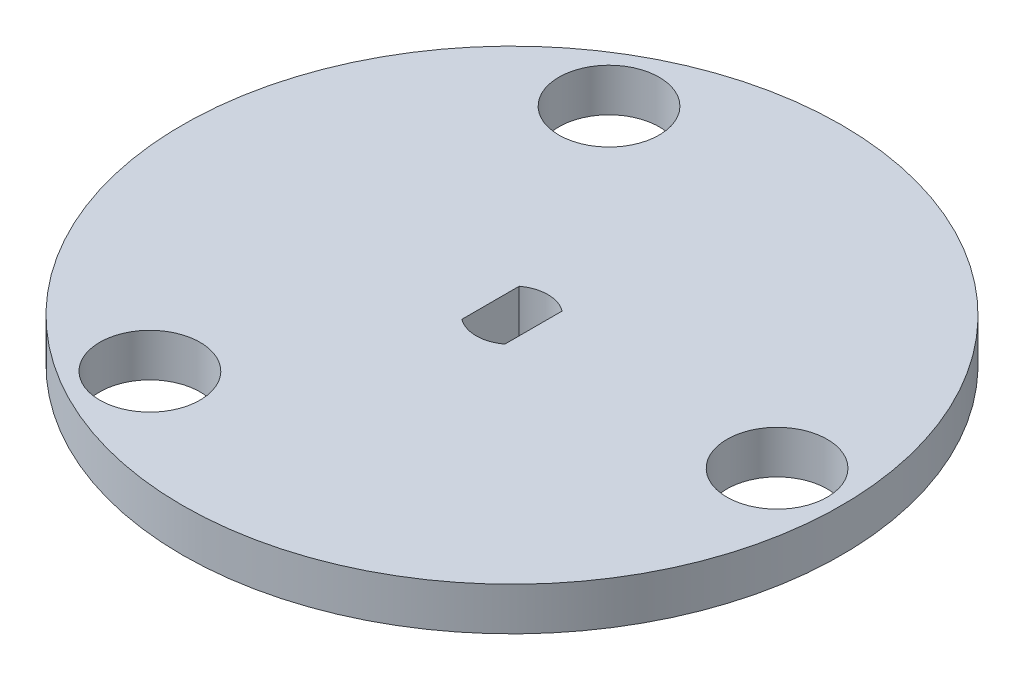
from build123d import *

# Parameters (mm, degrees)
CROQUIS1_R              = 23
CROQUIS1_R_2            = 3.5
SALIENTE_EXTRUIR1_DEPTH = 3


with BuildPart() as part:
    # Croquis1 → Saliente-Extruir1 (new body)
    with BuildSketch(Plane(origin=(0, 0, 0), x_dir=(1, 0, 0), z_dir=(0, 1, 0))):
        Circle(CROQUIS1_R)
        with BuildLine():
            ThreePointArc((-5.75, -16.02146997), (-12.281088913, -17.77146997), (-7.5, -12.990381057))
            ThreePointArc((-7.5, -12.990381057), (-6.218911087, -14.27146997), (-5.75, -16.02146997))
        make_face(mode=Mode.SUBTRACT)
        with Locations((-9.25, 16.02146997)):
            Circle(CROQUIS1_R_2, mode=Mode.SUBTRACT)
        with BuildLine():
            Line((1.5, 2), (1.5, 0))
            Line((1.5, 0), (1.5, -2))
            ThreePointArc((1.5, -2), (0.149788152, -2.495508667), (-1.25, -2.165063509))
            ThreePointArc((-1.25, -2.165063509), (-1.377474679, -2.086279825), (-1.5, -2))
            Line((-1.5, -2), (-1.5, 0))
            Line((-1.5, 0), (-1.5, 2))
            ThreePointArc((-1.5, 2), (0, 2.5), (1.5, 2))
        make_face(mode=Mode.SUBTRACT)
        with Locations((18.5, 0)):
            Circle(CROQUIS1_R_2, mode=Mode.SUBTRACT)
    extrude(amount=SALIENTE_EXTRUIR1_DEPTH)


solid = part.part
